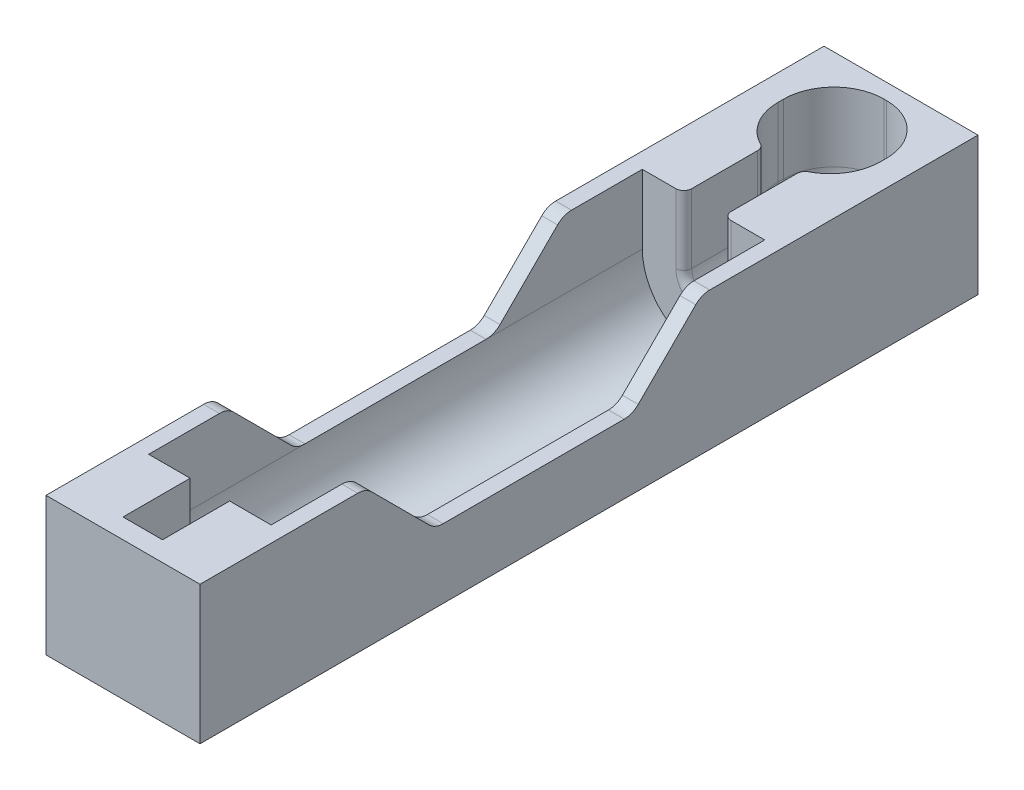
from build123d import *

# Parameters (mm, degrees)
BOSS_EXTRUDE3_DEPTH  = 125
SKETCH4_W            = 35
SKETCH4_H            = 35
BOSS_EXTRUDE4_DEPTH  = 20
CUT_EXTRUDE2_DEPTH   = 17
SKETCH6_W            = 35
SKETCH6_H            = 35
BOSS_EXTRUDE5_DEPTH  = 48
CUT_EXTRUDE3_START   = -20
CUT_EXTRUDE3_DEPTH   = 20
CUT_EXTRUDE4_DEPTH   = 26
FILLET1_R            = 12.7
FILLET2_R            = 2
SKETCH9_W            = 193
SKETCH9_H            = 35
BOSS_EXTRUDE6_DEPTH  = 2
SKETCH10_W           = 193
SKETCH10_H           = 35
BOSS_EXTRUDE7_DEPTH  = 2
SKETCH11_W           = 39
SKETCH11_H           = 35
BOSS_EXTRUDE8_DEPTH  = 2
SKETCH12_W           = 39
SKETCH12_H           = 35
BOSS_EXTRUDE9_DEPTH  = 2
SKETCH13_W           = 85
SKETCH13_H           = 17.5
CUT_EXTRUDE5_DEPTH   = 154.089026398
BOSS_EXTRUDE10_DEPTH = 4
BOSS_EXTRUDE11_DEPTH = 4
FILLET3_START        = -20
FILLET3_DEPTH        = 40
FILLET3_START_2      = -19.5
FILLET3_2_DEPTH      = 4
FILLET3_START_3      = 15.5
FILLET3_3_DEPTH      = 4


with BuildPart() as part:
    # Sketch1 → Boss-Extrude3 (new body)
    with BuildSketch(Plane.XY):
        with BuildLine():
            Line((0, -17.5), (-17.5, -17.5))
            Line((-17.5, -17.5), (-17.5, 0))
            Line((-17.5, 0), (-17.5, 17.5))
            Line((-17.5, 17.5), (-15.5, 17.5))
            Line((-15.5, 17.5), (-15.5, 0))
            ThreePointArc((-15.5, 0), (0, -15.5), (15.5, 0))
            Line((15.5, 0), (15.5, 17.5))
            Line((15.5, 17.5), (17.5, 17.5))
            Line((17.5, 17.5), (17.5, 0))
            Line((17.5, 0), (17.5, -17.5))
            Line((17.5, -17.5), (0, -17.5))
        make_face()
    extrude(amount=BOSS_EXTRUDE3_DEPTH)

    # Sketch4 → Boss-Extrude4 (add)
    with BuildSketch(Plane.XY.offset(125)):
        Rectangle(SKETCH4_W, SKETCH4_H)
    extrude(amount=BOSS_EXTRUDE4_DEPTH)

    # Sketch5 → Cut-Extrude2 (cut)
    with BuildSketch(Plane(origin=(0, 0, 125), x_dir=(-1, 0, 0), z_dir=(0, 0, -1))):
        with BuildLine():
            Line((-5, 0), (-5, 17.5))
            Line((-5, 17.5), (5, 17.5))
            Line((5, 17.5), (5, 0))
            ThreePointArc((5, 0), (0, -5), (-5, 0))
        make_face()
    extrude(amount=-CUT_EXTRUDE2_DEPTH, mode=Mode.SUBTRACT)

    # Sketch6 → Boss-Extrude5 (add)
    with BuildSketch(Plane(origin=(0, 0, 0), x_dir=(-1, 0, 0), z_dir=(0, 0, -1))):
        Rectangle(SKETCH6_W, SKETCH6_H)
    extrude(amount=BOSS_EXTRUDE5_DEPTH)

    # Sketch7 → Cut-Extrude3 (cut)
    with BuildSketch(Plane.XY.offset(CUT_EXTRUDE3_START)):
        with BuildLine():
            Line((-5, 0), (-5, 17.5))
            Line((-5, 17.5), (5, 17.5))
            Line((5, 17.5), (5, 0))
            ThreePointArc((5, 0), (0, -5), (-5, 0))
        make_face()
    extrude(amount=CUT_EXTRUDE3_DEPTH, mode=Mode.SUBTRACT)

    # Sketch8 → Cut-Extrude4 (cut)
    with BuildSketch(Plane.XY.offset(-20)):
        with BuildLine():
            Line((-13, 0), (-13, 27.339362416))
            Line((-13, 27.339362416), (13, 27.339362416))
            Line((13, 27.339362416), (13, 0))
            ThreePointArc((13, 0), (0, -13), (-13, 0))
        make_face()
    extrude(amount=-CUT_EXTRUDE4_DEPTH, mode=Mode.SUBTRACT)

    # Fillet1
    # the kernel refuses this fillet: 12.7 mm, written as the material it adds along each edge
    with BuildSketch(Plane(origin=(13, 17.5, -20), x_dir=(-1, 0, 0), z_dir=(0, -1, 0)), Plane(origin=(-13, 0, -20), x_dir=(1, 0, 0), z_dir=(0, 1, 0))) as fillet1_piece_1:
        with BuildLine():
            CenterArc((12.7, 11.798304963), FILLET1_R, 180, 68.279526527)
            Line((0, 11.798304963), (-0.254, 11.798304963))
            Line((-0.254, 11.798304963), (-0.254, 0))
            Line((-0.254, 0), (0, -0.254))
            ThreePointArc((0, -0.254), (4, -0.254), (7.906, -0.235966099))
            Line((7.906, -0.235966099), (8, 0))
        make_face()
    extrude(amount=17.5)
    with BuildSketch(Plane(origin=(0, 0, -20), x_dir=(1, 0, 0), z_dir=(0, 1, 0))) as fillet1_piece_2:
        with BuildLine():
            CenterArc((0.3, 11.798304963), FILLET1_R, 291.720473473, 68.279526527)
            Line((13, 11.798304963), (13.254, 11.798304963))
            Line((13.254, 11.798304963), (13.254, 0))
            Line((13.254, 0), (13, -0.254))
            ThreePointArc((13, -0.254), (9, -0.254), (5.094, -0.235966099))
            Line((5.094, -0.235966099), (5, 0))
        make_face()
    revolve(axis=Axis((0, 0, -20), (0, 0, -1)), revolution_arc=180)
    with BuildSketch(Plane(origin=(13, 17.5, -46), x_dir=(0, 0, 1), z_dir=(0, -1, 0))) as fillet1_piece_3:
        with BuildLine():
            CenterArc((FILLET1_R, FILLET1_R), FILLET1_R, 180, 90)
            Line((0, FILLET1_R), (-FILLET1_R * 0.02, FILLET1_R))
            Line((-FILLET1_R * 0.02, FILLET1_R), (-FILLET1_R * 0.02, -FILLET1_R * 0.02))
            Line((-FILLET1_R * 0.02, -FILLET1_R * 0.02), (FILLET1_R, -FILLET1_R * 0.02))
            Line((FILLET1_R, -FILLET1_R * 0.02), (FILLET1_R, 0))
        make_face()
    extrude(amount=17.5)
    with BuildSketch(Plane(origin=(0, 0, -46), x_dir=(1, 0, 0), z_dir=(0, 1, 0))) as fillet1_piece_4:
        with BuildLine():
            CenterArc((13 - FILLET1_R, -FILLET1_R), FILLET1_R, 0, 90)
            Line((13, -FILLET1_R), (13 + FILLET1_R * 0.02, -FILLET1_R))
            Line((13 + FILLET1_R * 0.02, -FILLET1_R), (13 + FILLET1_R * 0.02, FILLET1_R * 0.02))
            Line((13 + FILLET1_R * 0.02, FILLET1_R * 0.02), (13 - FILLET1_R, FILLET1_R * 0.02))
            Line((13 - FILLET1_R, FILLET1_R * 0.02), (13 - FILLET1_R, 0))
        make_face()
    revolve(axis=Axis((0, 0, -46), (0, 0, -1)), revolution_arc=180)
    with BuildSketch(Plane(origin=(-13, 0, -46), x_dir=(1, 0, 0), z_dir=(0, 1, 0))) as fillet1_piece_5:
        with BuildLine():
            CenterArc((FILLET1_R, -FILLET1_R), FILLET1_R, 90, 90)
            Line((0, -FILLET1_R), (-FILLET1_R * 0.02, -FILLET1_R))
            Line((-FILLET1_R * 0.02, -FILLET1_R), (-FILLET1_R * 0.02, FILLET1_R * 0.02))
            Line((-FILLET1_R * 0.02, FILLET1_R * 0.02), (FILLET1_R, FILLET1_R * 0.02))
            Line((FILLET1_R, FILLET1_R * 0.02), (FILLET1_R, 0))
        make_face()
    extrude(amount=17.5)

    # Fillet2
    fillet2_edges = [part.edges().sort_by_distance(p)[0] for p in [
        (0, -5, -20),
        (-5, 8.75, -20),
        (5, 8.75, -20),
        (0, -5, 0),
        (5, 8.75, 0),
        (-5, 8.75, 0),
    ]]
    fillet(fillet2_edges, radius=FILLET2_R)

    # Sketch9 → Boss-Extrude6 (add)
    with BuildSketch(Plane.ZY.offset(17.5)):
        with Locations((48.5, 0)):
            Rectangle(SKETCH9_W, SKETCH9_H)
    extrude(amount=BOSS_EXTRUDE6_DEPTH)

    # Sketch10 → Boss-Extrude7 (add)
    with BuildSketch(Plane(origin=(17.5, 0, 0), x_dir=(0, 0, -1), z_dir=(1, 0, 0))):
        with Locations((-48.5, 0)):
            Rectangle(SKETCH10_W, SKETCH10_H)
    extrude(amount=BOSS_EXTRUDE7_DEPTH)

    # Sketch11 → Boss-Extrude8 (add)
    with BuildSketch(Plane(origin=(0, 0, -48), x_dir=(-1, 0, 0), z_dir=(0, 0, -1))):
        Rectangle(SKETCH11_W, SKETCH11_H)
    extrude(amount=BOSS_EXTRUDE8_DEPTH)

    # Sketch12 → Boss-Extrude9 (add)
    with BuildSketch(Plane.XY.offset(145)):
        Rectangle(SKETCH12_W, SKETCH12_H)
    extrude(amount=BOSS_EXTRUDE9_DEPTH)

    # Sketch13 → Cut-Extrude5 (cut, through all)
    with BuildSketch(Plane(origin=(19.5, 0, 0), x_dir=(0, 0, -1), z_dir=(1, 0, 0))):
        with Locations((-62.5, 8.75)):
            Rectangle(SKETCH13_W, SKETCH13_H)
    extrude(amount=-CUT_EXTRUDE5_DEPTH, mode=Mode.SUBTRACT)

    # Sketch14 → Boss-Extrude10 (add)
    with BuildSketch(Plane(origin=(19.5, 0, 0), x_dir=(0, 0, -1), z_dir=(1, 0, 0))):
        Polygon((-105, 17.5), (-87.5, 0), (-105, 0), align=None)
        Polygon((-20, 0), (-20, 17.5), (-37.5, 0), align=None)
    extrude(amount=-BOSS_EXTRUDE10_DEPTH)

    # Sketch15 → Boss-Extrude11 (add)
    with BuildSketch(Plane.ZY.offset(19.5)):
        Polygon((20, 17.5), (37.5, 0), (20, 0), align=None)
        Polygon((105, 17.5), (87.5, 0), (105, 0), align=None)
    extrude(amount=-BOSS_EXTRUDE11_DEPTH)

    # Fillet3: read off the stored shape, not the designer's step
    # Fillet3 outline → Fillet3 (cut)
    with BuildSketch(Plane.YZ.offset(FILLET3_START)):
        with BuildLine():
            Line((17.5, 20), (16.035533906, 21.464466094))
            ThreePointArc((16.035533906, 21.464466094), (17.119397663, 19.84234935), (17.5, 17.928932188))
            Line((17.5, 17.928932188), (17.5, 20))
        make_face()
        with BuildLine():
            ThreePointArc((17.5, 107.071067812), (17.119397663, 105.15765065), (16.035533906, 103.535533906))
            Line((16.035533906, 103.535533906), (17.5, 105))
            Line((17.5, 105), (17.5, 107.071067812))
        make_face()
    extrude(amount=FILLET3_DEPTH, mode=Mode.SUBTRACT)

    # Fillet3 2 outline → Fillet3 2 (add)
    with BuildSketch(Plane.YZ.offset(FILLET3_START_2)):
        with BuildLine():
            Line((0, 87.5), (0, 85.428932188))
            ThreePointArc((0, 85.428932188), (0.380602337, 87.34234935), (1.464466094, 88.964466094))
            Line((1.464466094, 88.964466094), (0, 87.5))
        make_face()
        with BuildLine():
            Line((0, 37.5), (1.464466094, 36.035533906))
            ThreePointArc((1.464466094, 36.035533906), (0.380602337, 37.65765065), (0, 39.571067812))
            Line((0, 39.571067812), (0, 37.5))
        make_face()
    extrude(amount=FILLET3_2_DEPTH)

    # Fillet3 3 outline → Fillet3 3 (add)
    with BuildSketch(Plane.YZ.offset(FILLET3_START_3)):
        with BuildLine():
            Line((0, 87.5), (0, 85.428932188))
            ThreePointArc((0, 85.428932188), (0.380602337, 87.34234935), (1.464466094, 88.964466094))
            Line((1.464466094, 88.964466094), (0, 87.5))
        make_face()
        with BuildLine():
            Line((0, 37.5), (1.464466094, 36.035533906))
            ThreePointArc((1.464466094, 36.035533906), (0.380602337, 37.65765065), (0, 39.571067812))
            Line((0, 39.571067812), (0, 37.5))
        make_face()
    extrude(amount=FILLET3_3_DEPTH)


solid = part.part
